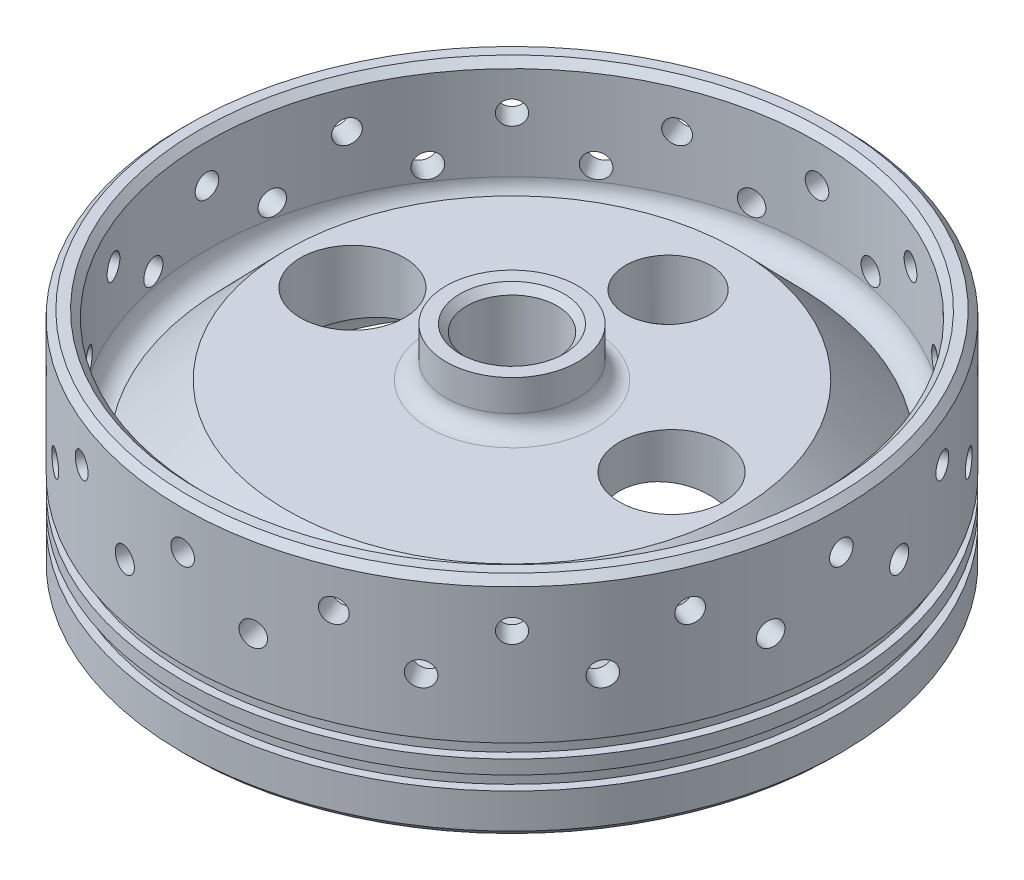
from build123d import *

# Parameters (mm, degrees)
CIRPATTERN1_COUNT          = 16
CHAMFER2_SIZE              = 2
CUT_EXTRUDE1_DEPTH         = 143.500000167
CUT_EXTRUDE1_DEPTH_BACK    = 143.500000167
SKETCH8_R                  = 13
SKETCH8_R_2                = 15
FILLET1_R                  = 6
SFAZOWANIE1_SIZE           = 2
ZAOKR_GLENIE4_R            = 5
SFAZOWANIE3_SIZE           = 2
SFAZOWANIE4_SIZE           = 2
SZKIC7_R                   = 12.25
WYTNIJ_WYCI_GNI_CIE1_DEPTH = 20


with BuildPart() as part:
    # Sketch1 → Revolve1 (revolve)
    with BuildSketch(Plane.XY, mode=Mode.PRIVATE) as revolve1_sk:
        with BuildLine():
            add(Edge.make_bspline(
                [(91, 0), (91, 37.5), (0, 37.5)],
                knots=[0, 0, 0, 1.570796327, 1.570796327, 1.570796327], degree=2, weights=[1, 0.707106781, 1]))
            Line((91, 0), (95, 0))
            Line((95, 0), (95, 12))
            Line((95, 12), (92.6, 12))
            Line((92.6, 12), (92.6, 16))
            Line((92.6, 16), (95, 16))
            Line((95, 16), (95, 20))
            Line((95, 20), (92.6, 20))
            Line((92.6, 20), (92.6, 24))
            Line((92.6, 24), (95, 24))
            Line((95, 24), (95, 65))
            Line((95, 65), (88, 65))
            Line((88, 65), (88, 30))
            Line((88, 30), (82, 30))
            Line((82, 30), (65, 47.5))
            Line((65, 47.5), (5.11929562, 47.5))
            Line((5.11929562, 47.5), (0, 47.5))
            Line((0, 47.5), (0, 37.5))
        make_face()
    revolve(revolve1_sk.sketch.rotate(Axis((0, 47.5, 0), (0, -1, 0)), 180), axis=Axis((0, 47.5, 0), (0, -1, 0)))

    # Sketch7 → Otwór gwintowany M8x1.252 (revolve, cut)
    with BuildSketch(Plane(origin=(-95, 52, 0), x_dir=(0, 0, 1), z_dir=(0, 1, 0))):
        Polygon((0, 0), (0, 17.042926105), (3.4, 15), (3.4, 0), align=None)
    otw_r_gwintowany_m8x1_252 = revolve(axis=Axis((-101.35, 52, 0), (1, 0, 0)), mode=Mode.SUBTRACT)

    # Szkic5 → Otwór gwintowany M8x1.01 (revolve, cut)
    with BuildSketch(Plane(origin=(-18.533580592, 40, -93.174601638), x_dir=(-0.9807852804032303, 0, 0.1950903220161287), z_dir=(0, 1, 0))):
        Polygon((0, 0), (0, 17.103012167), (3.5, 15), (3.5, 0), align=None)
    otw_r_gwintowany_m8x1_01 = revolve(axis=Axis((-19.772404136, 40, -99.402588169), (0.19509032201612872, 0, 0.9807852804032304)), mode=Mode.SUBTRACT)

    # CirPattern1: Otwór gwintowany M8x1.252, Otwór gwintowany M8x1.01 ×16 about axis
    cirpattern1_axis = Axis((0, 47.5, 0), (0, 1, 0))
    add([otw_r_gwintowany_m8x1_252.rotate(cirpattern1_axis, i * 360 / CIRPATTERN1_COUNT) for i in range(1, CIRPATTERN1_COUNT)], mode=Mode.SUBTRACT)
    add([otw_r_gwintowany_m8x1_01.rotate(cirpattern1_axis, i * 360 / CIRPATTERN1_COUNT) for i in range(1, CIRPATTERN1_COUNT)], mode=Mode.SUBTRACT)

    # Chamfer2
    chamfer2_edges = [part.edges().sort_by_distance(p)[0] for p in [
        (95, 0, 0),
    ]]
    chamfer(chamfer2_edges, length=CHAMFER2_SIZE)

    # Sketch8 → Cut-Extrude1 (cut, two sides: drawn at the far end of the back side and taken through both)
    with BuildSketch(Plane(origin=(0, 47.5, 0), x_dir=(1, 0, 0), z_dir=(0, 1, 0)).offset(-CUT_EXTRUDE1_DEPTH_BACK)):
        with Locations(Location((0, 0, 0), (0, 0, 180))):
            Circle(SKETCH8_R)
        with Locations((-46, 0)):
            Circle(SKETCH8_R_2)
        with Locations(Location((46, 0, 0), (0, 0, 180))):
            Circle(SKETCH8_R_2)
    extrude(amount=CUT_EXTRUDE1_DEPTH + CUT_EXTRUDE1_DEPTH_BACK, mode=Mode.SUBTRACT)

    # Fillet1
    fillet1_edges = [part.edges().sort_by_distance(p)[0] for p in [
        (88, 30, 0),
    ]]
    fillet(fillet1_edges, radius=FILLET1_R - 0.0001)  # a hair under: the kernel refuses the full size

    # Sfazowanie1
    sfazowanie1_edges = [part.edges().sort_by_distance(p)[0] for p in [
        (88, 65, 0),
        (95, 65, 0),
    ]]
    chamfer(sfazowanie1_edges, length=SFAZOWANIE1_SIZE)

    # Szkic6 → Obrót1 (revolve)
    with BuildSketch(Plane(origin=(0, 0, 0), x_dir=(0, 0, -1), z_dir=(1, 0, 0)), mode=Mode.PRIVATE) as obr_t1_sk:
        Polygon((-13, 61.5), (-13, 31.5), (-19, 31.5), (-19, 47.5), (-19, 61.5), align=None)
    revolve(obr_t1_sk.sketch.rotate(Axis((0, 67.878263554, 0), (0, -1, 0)), 270), axis=Axis((0, 67.878263554, 0), (0, -1, 0)))

    # Zaokrąglenie3: read off the stored shape, not the designer's step
    # Zaokrąglenie3 outline → Zaokrąglenie3 (revolve)
    with BuildSketch(Plane.XY):
        with BuildLine():
            ThreePointArc((23, 36.258884741), (23.218687861, 36.25290222), (23.436721569, 36.234972551))
            Line((23.436721569, 36.234972551), (23.436721569, 36.258884841))
            Line((23.436721569, 36.258884841), (23, 36.258884741))
        make_face()
        with BuildLine():
            Line((23, 36.258884741), (19, 36.258884841))
            Line((19, 36.258884841), (19, 32.258884741))
            ThreePointArc((19, 32.258884741), (20.171572875, 35.087311866), (23, 36.258884741))
        make_face()
    revolve(axis=Axis((0, 0, 0), (0, 1, 0)))

    # Zaokr_glenie3 2 outline → Zaokr_glenie3 2 (revolve)
    with BuildSketch(Plane.XY):
        with BuildLine():
            add(Edge.make_bspline(
                [(19, 36.673509002), (21.120950222, 36.486909122), (23.217921358, 36.25888484)],
                knots=[4.922727744, 4.922727744, 4.922727744, 4.970383534, 4.970383534, 4.970383534], degree=2, weights=[1, 0.999716129, 1]))
            Line((19, 36.673509002), (19, 36.258884841))
            Line((19, 36.258884841), (23, 36.258884741))
            Line((23, 36.258884741), (23.217921358, 36.25888484))
        make_face()
    revolve(axis=Axis((0, 0, 0), (0, 1, 0)))

    # Zaokrąglenie4
    zaokr_glenie4_edges = [part.edges().sort_by_distance(p)[0] for p in [
        (-19, 47.5, 0),
    ]]
    fillet(zaokr_glenie4_edges, radius=ZAOKR_GLENIE4_R)

    # Sfazowanie3
    # the kernel refuses this chamfer: 2 mm, written as the material it takes off along each edge
    with BuildSketch(Plane(origin=(0, 61.5, 0), x_dir=(1, 0, 0), z_dir=(0, 0, -1))) as sfazowanie3_piece_1:
        Polygon((13 + SFAZOWANIE3_SIZE, 0), (13, SFAZOWANIE3_SIZE), (13, 0), align=None)
    revolve(axis=Axis((0, 61.5, 0), (0, -1, 0)), mode=Mode.SUBTRACT)

    # Sfazowanie4
    # the kernel refuses this chamfer: 2 mm, written as the material it takes off along each edge
    with BuildSketch(Plane(origin=(0, 31.5, 0), x_dir=(1, 0, 0), z_dir=(0, 0, -1))) as sfazowanie4_piece_1:
        Polygon((13, -SFAZOWANIE4_SIZE), (13 + SFAZOWANIE4_SIZE, 0), (13, 0), align=None)
    revolve(axis=Axis((0, 31.5, 0), (0, -1, 0)), mode=Mode.SUBTRACT)

    # Szkic7 → Wytnij-wyciągnięcie1 (cut)
    with BuildSketch(Plane(origin=(0, 47.5, 0), x_dir=(1, 0, 0), z_dir=(0, 1, 0))):
        with Locations(Location((0, 45, 0), (0, 0, 180))):
            Circle(SZKIC7_R)
    extrude(amount=-WYTNIJ_WYCI_GNI_CIE1_DEPTH, mode=Mode.SUBTRACT)


solid = part.part
